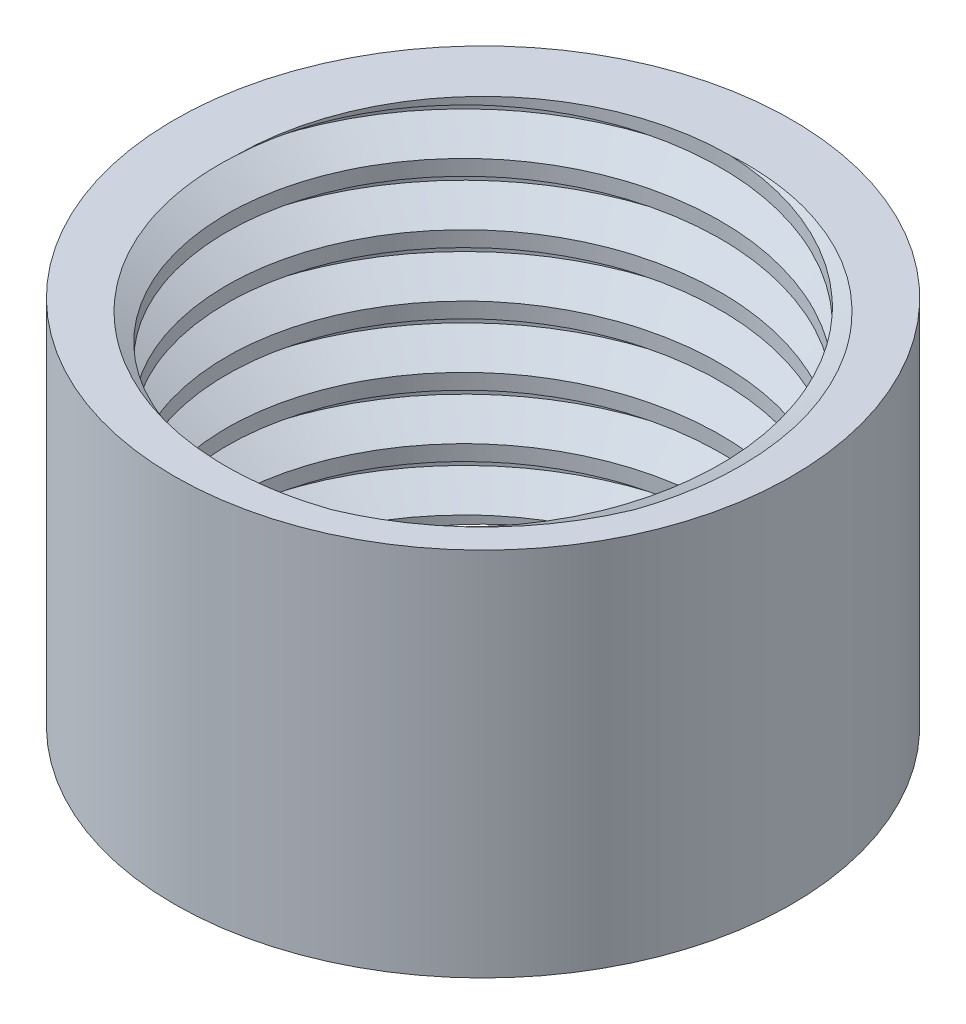
from build123d import *

# Parameters (mm, degrees)
SKETCH1_R           = 5
SKETCH1_R_2         = 4
BOSS_EXTRUDE1_DEPTH = 6
THREAD1_PITCH       = 1


with BuildPart() as part:
    # Sketch1 → Boss-Extrude1 (new body)
    with BuildSketch(Plane(origin=(0, 0, 0), x_dir=(1, 0, 0), z_dir=(0, 1, 0))):
        with Locations(Location((0, 0, 0), (0, 0, 270))):
            Circle(SKETCH1_R)
        with Locations(Location((0, 0, 0), (0, 0, 270))):
            Circle(SKETCH1_R_2, mode=Mode.SUBTRACT)
    extrude(amount=BOSS_EXTRUDE1_DEPTH)

    # Thread1: the profile of Thread Profile1 profile screwed along a right-hand helix of 7 turns, 8 arcs to a turn; built about Z, then put on its axis
    thread1_z = Axis((0, 0, 0), (0, 0, 1))
    thread1_corners = [(3.9997, 0, -0.000173205), (4.541265875, 0, 0.312499999), (4.541265875, 0, 0.437499999), (3.9997, 0, 0.750173202)]
    with BuildLine(mode=Mode.PRIVATE) as thread1_profile:
        Line(thread1_corners[0], thread1_corners[1])
        Line(thread1_corners[1], thread1_corners[2])
        Line(thread1_corners[2], thread1_corners[3])
        Line(thread1_corners[3], thread1_corners[0])
    thread1_cap = Face(thread1_profile.wire())
    thread1_turn_angles = [0, 22.5, 45, 67.5, 90, 112.5, 135, 157.5, 180, 202.5, 225, 247.5, 270, 292.5, 315, 337.5, 360]
    thread1_turn_weights = [1, 0.9238795325112867, 1, 0.9238795325112867, 1, 0.9238795325112867, 1, 0.9238795325112867, 1, 0.9238795325112867, 1, 0.9238795325112867, 1, 0.9238795325112867, 1, 0.9238795325112867, 1]
    thread1_turn_rails = [Edge.make_bspline([Vector(p[0], p[1], 0).rotate(thread1_z, thread1_turn_angles[k]) / thread1_turn_weights[k] + Vector(0, 0, p[2] + THREAD1_PITCH * thread1_turn_angles[k] / 360) for k in range(17)], [0, 0, 0, 1, 1, 2, 2, 3, 3, 4, 4, 5, 5, 6, 6, 7, 7, 8, 8, 8], 2, thread1_turn_weights) for p in thread1_corners]
    thread1_turn_sides = [Face.make_surface_from_curves(thread1_turn_rails[p[0]], thread1_turn_rails[p[1]]) for p in [(0, 1), (1, 2), (2, 3), (3, 0)]]
    thread1 = Plane(origin=(0, 7, 0), x_dir=(-1, 0, 0), z_dir=(0, -1, 0)) * Solid(Shell([*[p.moved(Location((0, 0, THREAD1_PITCH * i))) for i in range(7) for p in thread1_turn_sides], thread1_cap, thread1_cap.rotate(thread1_z, 2520).moved(Location((0, 0, THREAD1_PITCH * 2520 / 360)))]))
    add(thread1, mode=Mode.SUBTRACT)


solid = part.part
